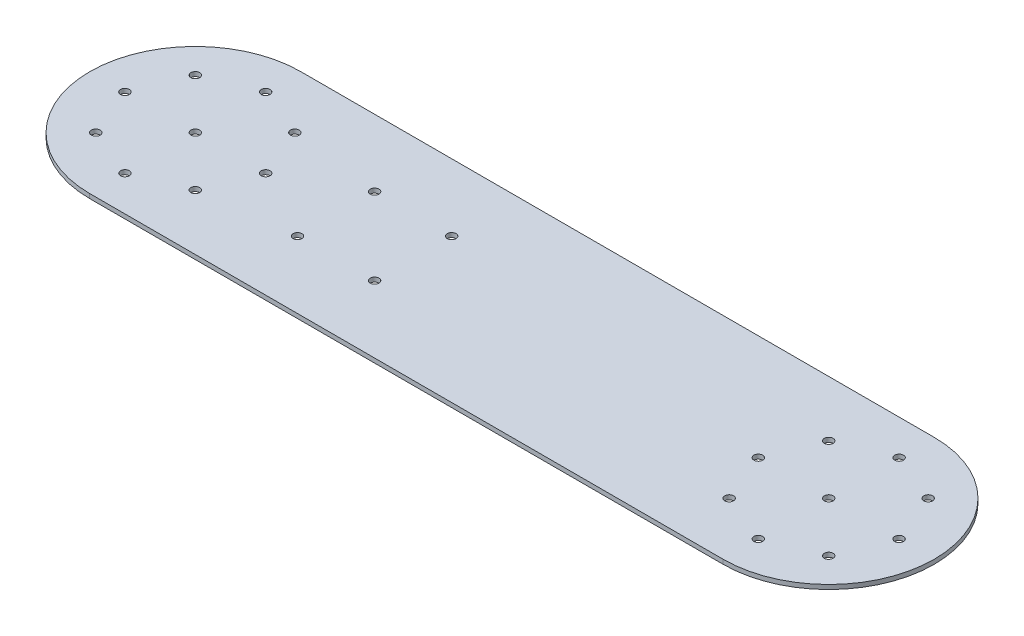
from build123d import *

# Parameters (mm, degrees)
SKETCH1_R               = 3.175
BOSS_EXTRUDE1_DEPTH     = 3.175
SKETCH3_R               = 3.175
CUT_EXTRUDE1_DEPTH      = 315.196690984
CIRPATTERN1_COUNT       = 8
MIRROR1_COPY_1_SKETCH_R = 3.175
MIRROR1_COPY_1_DEPTH    = 315.196690984
MIRROR1_COPY_2_SKETCH_R = 3.175
MIRROR1_COPY_2_DEPTH    = 315.196690984
MIRROR1_COPY_3_SKETCH_R = 3.175
MIRROR1_COPY_3_DEPTH    = 315.196690984
MIRROR1_COPY_4_SKETCH_R = 3.175
MIRROR1_COPY_4_DEPTH    = 315.196690984
MIRROR1_COPY_5_SKETCH_R = 3.175
MIRROR1_COPY_5_DEPTH    = 315.196690984
MIRROR1_COPY_6_SKETCH_R = 3.175
MIRROR1_COPY_6_DEPTH    = 315.196690984
MIRROR1_COPY_7_SKETCH_R = 3.175
MIRROR1_COPY_7_DEPTH    = 315.196690984
MIRROR1_COPY_8_SKETCH_R = 3.175
MIRROR1_COPY_8_DEPTH    = 315.196690984


with BuildPart() as part:
    # Sketch1 → Boss-Extrude1 (new body)
    with BuildSketch(Plane(origin=(0, 0, 0), x_dir=(1, 0, 0), z_dir=(0, 1, 0))):
        with BuildLine():
            Line((-228.6, -76.2), (228.6, -76.2))
            ThreePointArc((228.6, -76.2), (304.8, 0), (228.6, 76.2))
            Line((228.6, 76.2), (-228.6, 76.2))
            ThreePointArc((-228.6, 76.2), (-304.8, 0), (-228.6, -76.2))
        make_face()
        with Locations((-127, 27.813)):
            Circle(SKETCH1_R, mode=Mode.SUBTRACT)
        with Locations((-127, -27.813)):
            Circle(SKETCH1_R, mode=Mode.SUBTRACT)
        with Locations((-71.374, -27.813)):
            Circle(SKETCH1_R, mode=Mode.SUBTRACT)
        with Locations((-71.374, 27.813)):
            Circle(SKETCH1_R, mode=Mode.SUBTRACT)
    extrude(amount=BOSS_EXTRUDE1_DEPTH)

    # Sketch3 → Cut-Extrude1 (cut, through all)
    with BuildSketch(Plane(origin=(0, 3.175, 0), x_dir=(1, 0, 0), z_dir=(0, 1, 0))):
        with Locations((-228.6, 50.8)):
            Circle(SKETCH3_R)
        with Locations((-228.6, 0)):
            Circle(SKETCH3_R)
    cut_extrude1 = extrude(amount=-CUT_EXTRUDE1_DEPTH, mode=Mode.SUBTRACT)

    # CirPattern1: Cut-Extrude1 ×8 about axis
    cirpattern1_axis = Axis((-228.6, 0, 0), (0, 1, 0))
    for i in range(1, CIRPATTERN1_COUNT):
        add(cut_extrude1.rotate(cirpattern1_axis, i * 360 / CIRPATTERN1_COUNT), mode=Mode.SUBTRACT)

    # Mirror1 copy 1 sketch → Mirror1 copy 1 (cut, through all)
    with BuildSketch(Plane(origin=(66.955389821, 3.175, -161.644610179), x_dir=(-0.7071067811865476, 0, -0.7071067811865475), z_dir=(0, 1, 0))):
        with Locations((-228.6, -50.8)):
            Circle(MIRROR1_COPY_1_SKETCH_R)
        with Locations((-228.6, 0)):
            Circle(MIRROR1_COPY_1_SKETCH_R)
    extrude(amount=-MIRROR1_COPY_1_DEPTH, mode=Mode.SUBTRACT)

    # Mirror1 copy 2 sketch → Mirror1 copy 2 (cut, through all)
    with BuildSketch(Plane(origin=(228.6, 3.175, -228.6), x_dir=(0, 0, -1), z_dir=(0, 1, 0))):
        with Locations((-228.6, -50.8)):
            Circle(MIRROR1_COPY_2_SKETCH_R)
        with Locations((-228.6, 0)):
            Circle(MIRROR1_COPY_2_SKETCH_R)
    extrude(amount=-MIRROR1_COPY_2_DEPTH, mode=Mode.SUBTRACT)

    # Mirror1 copy 3 sketch → Mirror1 copy 3 (cut, through all)
    with BuildSketch(Plane(origin=(390.244610179, 3.175, -161.644610179), x_dir=(0.7071067811865475, 0, -0.7071067811865476), z_dir=(0, 1, 0))):
        with Locations((-228.6, -50.8)):
            Circle(MIRROR1_COPY_3_SKETCH_R)
        with Locations((-228.6, 0)):
            Circle(MIRROR1_COPY_3_SKETCH_R)
    extrude(amount=-MIRROR1_COPY_3_DEPTH, mode=Mode.SUBTRACT)

    # Mirror1 copy 4 sketch → Mirror1 copy 4 (cut, through all)
    with BuildSketch(Plane(origin=(457.2, 3.175, 0), x_dir=(1, 0, 0), z_dir=(0, 1, 0))):
        with Locations((-228.6, -50.8)):
            Circle(MIRROR1_COPY_4_SKETCH_R)
        with Locations((-228.6, 0)):
            Circle(MIRROR1_COPY_4_SKETCH_R)
    extrude(amount=-MIRROR1_COPY_4_DEPTH, mode=Mode.SUBTRACT)

    # Mirror1 copy 5 sketch → Mirror1 copy 5 (cut, through all)
    with BuildSketch(Plane(origin=(390.244610179, 3.175, 161.644610179), x_dir=(0.7071067811865477, 0, 0.7071067811865475), z_dir=(0, 1, 0))):
        with Locations((-228.6, -50.8)):
            Circle(MIRROR1_COPY_5_SKETCH_R)
        with Locations((-228.6, 0)):
            Circle(MIRROR1_COPY_5_SKETCH_R)
    extrude(amount=-MIRROR1_COPY_5_DEPTH, mode=Mode.SUBTRACT)

    # Mirror1 copy 6 sketch → Mirror1 copy 6 (cut, through all)
    with BuildSketch(Plane(origin=(228.6, 3.175, 228.6), x_dir=(0, 0, 1), z_dir=(0, 1, 0))):
        with Locations((-228.6, -50.8)):
            Circle(MIRROR1_COPY_6_SKETCH_R)
        with Locations((-228.6, 0)):
            Circle(MIRROR1_COPY_6_SKETCH_R)
    extrude(amount=-MIRROR1_COPY_6_DEPTH, mode=Mode.SUBTRACT)

    # Mirror1 copy 7 sketch → Mirror1 copy 7 (cut, through all)
    with BuildSketch(Plane(origin=(66.955389821, 3.175, 161.644610179), x_dir=(-0.7071067811865474, 0, 0.7071067811865477), z_dir=(0, 1, 0))):
        with Locations((-228.6, -50.8)):
            Circle(MIRROR1_COPY_7_SKETCH_R)
        with Locations((-228.6, 0)):
            Circle(MIRROR1_COPY_7_SKETCH_R)
    extrude(amount=-MIRROR1_COPY_7_DEPTH, mode=Mode.SUBTRACT)

    # Mirror1 copy 8 sketch → Mirror1 copy 8 (cut, through all)
    with BuildSketch(Plane(origin=(0, 3.175, 0), x_dir=(-1, 0, 0), z_dir=(0, 1, 0))):
        with Locations((-228.6, -50.8)):
            Circle(MIRROR1_COPY_8_SKETCH_R)
        with Locations((-228.6, 0)):
            Circle(MIRROR1_COPY_8_SKETCH_R)
    extrude(amount=-MIRROR1_COPY_8_DEPTH, mode=Mode.SUBTRACT)


solid = part.part
